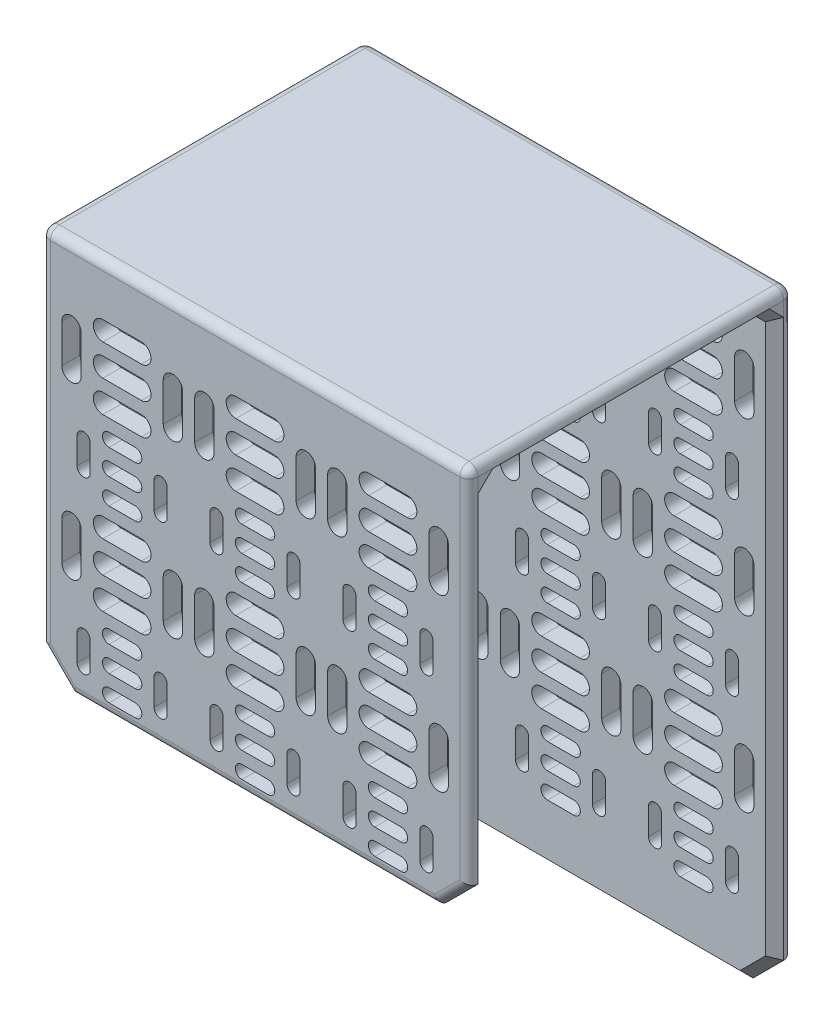
from build123d import *

# Parameters (mm, degrees)
ESQUISSE1_W                           = 70
ESQUISSE1_H                           = 100
BOSS_EXTRU_1_DEPTH                    = 3
ESQUISSE2_W                           = 70
ESQUISSE2_H                           = 3
BOSS_EXTRU_2_DEPTH                    = 50
ESQUISSE3_W                           = 70
ESQUISSE3_H                           = 3
BOSS_EXTRU_3_DEPTH                    = 61.2
ENL_V_MAT_EXTRU_1_DEPTH               = 79.89866919
R_P_TITION_LIN_AIRE1_COUNT            = 2
R_P_TITION_LIN_AIRE1_PITCH            = 27.9
R_P_TITION_LIN_AIRE1_COL_COUNT        = 2
R_P_TITION_LIN_AIRE1_COL_PITCH        = 27.9
R_P_TITION_LIN_AIRE2_COUNT            = 2
R_P_TITION_LIN_AIRE2_PITCH            = 21.75
R_P_TITION_LIN_AIRE2_COPY_1_DEPTH     = 79.89866919
R_P_TITION_LIN_AIRE2_COPY_2_DEPTH     = 79.89866919
R_P_TITION_LIN_AIRE2_COL_COUNT        = 2
R_P_TITION_LIN_AIRE2_COL_PITCH        = 21.75
R_P_TITION_LIN_AIRE2_COL_COPY_1_DEPTH = 79.89866919
R_P_TITION_LIN_AIRE2_COL_COPY_2_DEPTH = 79.89866919
CHANFREIN1_SIZE                       = 1.5
CHANFREIN2_SIZE                       = 5
CHANFREIN3_SIZE                       = 1.5
CONG_1_R                              = 1.5


with BuildPart() as part:
    # Esquisse1 → Boss.-Extru.1 (new body)
    with BuildSketch(Plane.XY):
        Rectangle(ESQUISSE1_W, ESQUISSE1_H)
    extrude(amount=BOSS_EXTRU_1_DEPTH)

    # Esquisse2 → Boss.-Extru.2 (add)
    with BuildSketch(Plane.XY.offset(3)):
        with Locations((0, 48.5)):
            Rectangle(ESQUISSE2_W, ESQUISSE2_H)
    extrude(amount=BOSS_EXTRU_2_DEPTH)

    # Esquisse3 → Boss.-Extru.3 (add)
    with BuildSketch(Plane.XZ.offset(-47)):
        with Locations((0, 51.5)):
            Rectangle(ESQUISSE3_W, ESQUISSE3_H)
    extrude(amount=BOSS_EXTRU_3_DEPTH)

    # Esquisse4 → Enlèv. mat.-Extru.1 (cut, symmetric)
    with BuildSketch(Plane.XY.offset(3)):
        with BuildLine():
            Line((3.15, 8.55), (-3.15, 8.55))
            ThreePointArc((-3.15, 8.55), (-4.725, 6.975), (-3.15, 5.4))
            Line((-3.15, 5.4), (0, 5.4))
            Line((0, 5.4), (3.15, 5.4))
            ThreePointArc((3.15, 5.4), (4.725, 6.975), (3.15, 8.55))
        make_face()
        with BuildLine():
            Line((9.875, 3.825), (9.875, 10.125))
            ThreePointArc((9.875, 10.125), (8.3, 11.7), (6.725, 10.125))
            Line((6.725, 10.125), (6.725, 3.825))
            ThreePointArc((6.725, 3.825), (8.3, 2.25), (9.875, 3.825))
        make_face()
        with BuildLine():
            Line((-6.725, 3.825), (-6.725, 10.125))
            ThreePointArc((-6.725, 10.125), (-8.3, 11.7), (-9.875, 10.125))
            Line((-9.875, 10.125), (-9.875, 3.825))
            ThreePointArc((-9.875, 3.825), (-8.3, 2.25), (-6.725, 3.825))
        make_face()
        with BuildLine():
            Line((2.15, -5.9), (-2.15, -5.9))
            ThreePointArc((-2.15, -5.9), (-3.225, -6.975), (-2.15, -8.05))
            Line((-2.15, -8.05), (0, -8.05))
            Line((0, -8.05), (2.15, -8.05))
            ThreePointArc((2.15, -8.05), (3.225, -6.975), (2.15, -5.9))
        make_face()
        with BuildLine():
            Line((7.375, -9.125), (7.375, -4.825))
            ThreePointArc((7.375, -4.825), (6.3, -3.75), (5.225, -4.825))
            Line((5.225, -4.825), (5.225, -9.125))
            ThreePointArc((5.225, -9.125), (6.3, -10.2), (7.375, -9.125))
        make_face()
        with BuildLine():
            Line((-5.225, -9.125), (-5.225, -4.825))
            ThreePointArc((-5.225, -4.825), (-6.3, -3.75), (-7.375, -4.825))
            Line((-7.375, -4.825), (-7.375, -9.125))
            ThreePointArc((-7.375, -9.125), (-6.3, -10.2), (-5.225, -9.125))
        make_face()
        with BuildLine():
            Line((3.15, 13.7), (-3.15, 13.7))
            ThreePointArc((-3.15, 13.7), (-4.725, 12.125), (-3.15, 10.55))
            Line((-3.15, 10.55), (3.15, 10.55))
            ThreePointArc((3.15, 10.55), (4.725, 12.125), (3.15, 13.7))
        make_face()
        with BuildLine():
            Line((3.15, 3.4), (-3.15, 3.4))
            ThreePointArc((-3.15, 3.4), (-4.725, 1.825), (-3.15, 0.25))
            Line((-3.15, 0.25), (3.15, 0.25))
            ThreePointArc((3.15, 0.25), (4.725, 1.825), (3.15, 3.4))
        make_face()
        with BuildLine():
            Line((2.15, -1.75), (-2.15, -1.75))
            ThreePointArc((-2.15, -1.75), (-3.225, -2.825), (-2.15, -3.9))
            Line((-2.15, -3.9), (2.15, -3.9))
            ThreePointArc((2.15, -3.9), (3.225, -2.825), (2.15, -1.75))
        make_face()
        with BuildLine():
            Line((2.15, -10.05), (-2.15, -10.05))
            ThreePointArc((-2.15, -10.05), (-3.225, -11.125), (-2.15, -12.2))
            Line((-2.15, -12.2), (2.15, -12.2))
            ThreePointArc((2.15, -12.2), (3.225, -11.125), (2.15, -10.05))
        make_face()
    enl_v_mat_extru_1 = extrude(amount=ENL_V_MAT_EXTRU_1_DEPTH, both=True, mode=Mode.SUBTRACT)

    # Répétition linéaire1: Enlèv. mat.-Extru.1 ×2
    with Locations(*[(0, -i * R_P_TITION_LIN_AIRE1_PITCH, 0) for i in range(1, R_P_TITION_LIN_AIRE1_COUNT)]):
        add(enl_v_mat_extru_1, mode=Mode.SUBTRACT)

    # Répétition linéaire1 col: Enlèv. mat.-Extru.1 ×2
    with Locations(*[(0, i * R_P_TITION_LIN_AIRE1_COL_PITCH, 0) for i in range(1, R_P_TITION_LIN_AIRE1_COL_COUNT)]):
        add(enl_v_mat_extru_1, mode=Mode.SUBTRACT)

    # Répétition linéaire2: Enlèv. mat.-Extru.1 ×2
    with Locations(*[(-i * R_P_TITION_LIN_AIRE2_PITCH, 0, 0) for i in range(1, R_P_TITION_LIN_AIRE2_COUNT)]):
        add(enl_v_mat_extru_1, mode=Mode.SUBTRACT)

    # Répétition linéaire2 copy 1 sketch → Répétition linéaire2 copy 1 (cut, symmetric)
    with BuildSketch(Plane(origin=(-21.75, -27.9, 3), x_dir=(1, 0, 0), z_dir=(0, 0, 1))):
        with BuildLine():
            Line((3.15, 8.55), (-3.15, 8.55))
            ThreePointArc((-3.15, 8.55), (-4.725, 6.975), (-3.15, 5.4))
            Line((-3.15, 5.4), (0, 5.4))
            Line((0, 5.4), (3.15, 5.4))
            ThreePointArc((3.15, 5.4), (4.725, 6.975), (3.15, 8.55))
        make_face()
        with BuildLine():
            Line((9.875, 3.825), (9.875, 10.125))
            ThreePointArc((9.875, 10.125), (8.3, 11.7), (6.725, 10.125))
            Line((6.725, 10.125), (6.725, 3.825))
            ThreePointArc((6.725, 3.825), (8.3, 2.25), (9.875, 3.825))
        make_face()
        with BuildLine():
            Line((-6.725, 3.825), (-6.725, 10.125))
            ThreePointArc((-6.725, 10.125), (-8.3, 11.7), (-9.875, 10.125))
            Line((-9.875, 10.125), (-9.875, 3.825))
            ThreePointArc((-9.875, 3.825), (-8.3, 2.25), (-6.725, 3.825))
        make_face()
        with BuildLine():
            Line((2.15, -5.9), (-2.15, -5.9))
            ThreePointArc((-2.15, -5.9), (-3.225, -6.975), (-2.15, -8.05))
            Line((-2.15, -8.05), (0, -8.05))
            Line((0, -8.05), (2.15, -8.05))
            ThreePointArc((2.15, -8.05), (3.225, -6.975), (2.15, -5.9))
        make_face()
        with BuildLine():
            Line((7.375, -9.125), (7.375, -4.825))
            ThreePointArc((7.375, -4.825), (6.3, -3.75), (5.225, -4.825))
            Line((5.225, -4.825), (5.225, -9.125))
            ThreePointArc((5.225, -9.125), (6.3, -10.2), (7.375, -9.125))
        make_face()
        with BuildLine():
            Line((-5.225, -9.125), (-5.225, -4.825))
            ThreePointArc((-5.225, -4.825), (-6.3, -3.75), (-7.375, -4.825))
            Line((-7.375, -4.825), (-7.375, -9.125))
            ThreePointArc((-7.375, -9.125), (-6.3, -10.2), (-5.225, -9.125))
        make_face()
        with BuildLine():
            Line((3.15, 13.7), (-3.15, 13.7))
            ThreePointArc((-3.15, 13.7), (-4.725, 12.125), (-3.15, 10.55))
            Line((-3.15, 10.55), (3.15, 10.55))
            ThreePointArc((3.15, 10.55), (4.725, 12.125), (3.15, 13.7))
        make_face()
        with BuildLine():
            Line((3.15, 3.4), (-3.15, 3.4))
            ThreePointArc((-3.15, 3.4), (-4.725, 1.825), (-3.15, 0.25))
            Line((-3.15, 0.25), (3.15, 0.25))
            ThreePointArc((3.15, 0.25), (4.725, 1.825), (3.15, 3.4))
        make_face()
        with BuildLine():
            Line((2.15, -1.75), (-2.15, -1.75))
            ThreePointArc((-2.15, -1.75), (-3.225, -2.825), (-2.15, -3.9))
            Line((-2.15, -3.9), (2.15, -3.9))
            ThreePointArc((2.15, -3.9), (3.225, -2.825), (2.15, -1.75))
        make_face()
        with BuildLine():
            Line((2.15, -10.05), (-2.15, -10.05))
            ThreePointArc((-2.15, -10.05), (-3.225, -11.125), (-2.15, -12.2))
            Line((-2.15, -12.2), (2.15, -12.2))
            ThreePointArc((2.15, -12.2), (3.225, -11.125), (2.15, -10.05))
        make_face()
    extrude(amount=R_P_TITION_LIN_AIRE2_COPY_1_DEPTH, both=True, mode=Mode.SUBTRACT)

    # Répétition linéaire2 copy 2 sketch → Répétition linéaire2 copy 2 (cut, symmetric)
    with BuildSketch(Plane(origin=(-21.75, 27.9, 3), x_dir=(1, 0, 0), z_dir=(0, 0, 1))):
        with BuildLine():
            Line((3.15, 8.55), (-3.15, 8.55))
            ThreePointArc((-3.15, 8.55), (-4.725, 6.975), (-3.15, 5.4))
            Line((-3.15, 5.4), (0, 5.4))
            Line((0, 5.4), (3.15, 5.4))
            ThreePointArc((3.15, 5.4), (4.725, 6.975), (3.15, 8.55))
        make_face()
        with BuildLine():
            Line((9.875, 3.825), (9.875, 10.125))
            ThreePointArc((9.875, 10.125), (8.3, 11.7), (6.725, 10.125))
            Line((6.725, 10.125), (6.725, 3.825))
            ThreePointArc((6.725, 3.825), (8.3, 2.25), (9.875, 3.825))
        make_face()
        with BuildLine():
            Line((-6.725, 3.825), (-6.725, 10.125))
            ThreePointArc((-6.725, 10.125), (-8.3, 11.7), (-9.875, 10.125))
            Line((-9.875, 10.125), (-9.875, 3.825))
            ThreePointArc((-9.875, 3.825), (-8.3, 2.25), (-6.725, 3.825))
        make_face()
        with BuildLine():
            Line((2.15, -5.9), (-2.15, -5.9))
            ThreePointArc((-2.15, -5.9), (-3.225, -6.975), (-2.15, -8.05))
            Line((-2.15, -8.05), (0, -8.05))
            Line((0, -8.05), (2.15, -8.05))
            ThreePointArc((2.15, -8.05), (3.225, -6.975), (2.15, -5.9))
        make_face()
        with BuildLine():
            Line((7.375, -9.125), (7.375, -4.825))
            ThreePointArc((7.375, -4.825), (6.3, -3.75), (5.225, -4.825))
            Line((5.225, -4.825), (5.225, -9.125))
            ThreePointArc((5.225, -9.125), (6.3, -10.2), (7.375, -9.125))
        make_face()
        with BuildLine():
            Line((-5.225, -9.125), (-5.225, -4.825))
            ThreePointArc((-5.225, -4.825), (-6.3, -3.75), (-7.375, -4.825))
            Line((-7.375, -4.825), (-7.375, -9.125))
            ThreePointArc((-7.375, -9.125), (-6.3, -10.2), (-5.225, -9.125))
        make_face()
        with BuildLine():
            Line((3.15, 13.7), (-3.15, 13.7))
            ThreePointArc((-3.15, 13.7), (-4.725, 12.125), (-3.15, 10.55))
            Line((-3.15, 10.55), (3.15, 10.55))
            ThreePointArc((3.15, 10.55), (4.725, 12.125), (3.15, 13.7))
        make_face()
        with BuildLine():
            Line((3.15, 3.4), (-3.15, 3.4))
            ThreePointArc((-3.15, 3.4), (-4.725, 1.825), (-3.15, 0.25))
            Line((-3.15, 0.25), (3.15, 0.25))
            ThreePointArc((3.15, 0.25), (4.725, 1.825), (3.15, 3.4))
        make_face()
        with BuildLine():
            Line((2.15, -1.75), (-2.15, -1.75))
            ThreePointArc((-2.15, -1.75), (-3.225, -2.825), (-2.15, -3.9))
            Line((-2.15, -3.9), (2.15, -3.9))
            ThreePointArc((2.15, -3.9), (3.225, -2.825), (2.15, -1.75))
        make_face()
        with BuildLine():
            Line((2.15, -10.05), (-2.15, -10.05))
            ThreePointArc((-2.15, -10.05), (-3.225, -11.125), (-2.15, -12.2))
            Line((-2.15, -12.2), (2.15, -12.2))
            ThreePointArc((2.15, -12.2), (3.225, -11.125), (2.15, -10.05))
        make_face()
    extrude(amount=R_P_TITION_LIN_AIRE2_COPY_2_DEPTH, both=True, mode=Mode.SUBTRACT)

    # Répétition linéaire2 col: Enlèv. mat.-Extru.1 ×2
    with Locations(*[(i * R_P_TITION_LIN_AIRE2_COL_PITCH, 0, 0) for i in range(1, R_P_TITION_LIN_AIRE2_COL_COUNT)]):
        add(enl_v_mat_extru_1, mode=Mode.SUBTRACT)

    # Répétition linéaire2 col copy 1 sketch → Répétition linéaire2 col copy 1 (cut, symmetric)
    with BuildSketch(Plane(origin=(21.75, -27.9, 3), x_dir=(1, 0, 0), z_dir=(0, 0, 1))):
        with BuildLine():
            Line((3.15, 8.55), (-3.15, 8.55))
            ThreePointArc((-3.15, 8.55), (-4.725, 6.975), (-3.15, 5.4))
            Line((-3.15, 5.4), (0, 5.4))
            Line((0, 5.4), (3.15, 5.4))
            ThreePointArc((3.15, 5.4), (4.725, 6.975), (3.15, 8.55))
        make_face()
        with BuildLine():
            Line((9.875, 3.825), (9.875, 10.125))
            ThreePointArc((9.875, 10.125), (8.3, 11.7), (6.725, 10.125))
            Line((6.725, 10.125), (6.725, 3.825))
            ThreePointArc((6.725, 3.825), (8.3, 2.25), (9.875, 3.825))
        make_face()
        with BuildLine():
            Line((-6.725, 3.825), (-6.725, 10.125))
            ThreePointArc((-6.725, 10.125), (-8.3, 11.7), (-9.875, 10.125))
            Line((-9.875, 10.125), (-9.875, 3.825))
            ThreePointArc((-9.875, 3.825), (-8.3, 2.25), (-6.725, 3.825))
        make_face()
        with BuildLine():
            Line((2.15, -5.9), (-2.15, -5.9))
            ThreePointArc((-2.15, -5.9), (-3.225, -6.975), (-2.15, -8.05))
            Line((-2.15, -8.05), (0, -8.05))
            Line((0, -8.05), (2.15, -8.05))
            ThreePointArc((2.15, -8.05), (3.225, -6.975), (2.15, -5.9))
        make_face()
        with BuildLine():
            Line((7.375, -9.125), (7.375, -4.825))
            ThreePointArc((7.375, -4.825), (6.3, -3.75), (5.225, -4.825))
            Line((5.225, -4.825), (5.225, -9.125))
            ThreePointArc((5.225, -9.125), (6.3, -10.2), (7.375, -9.125))
        make_face()
        with BuildLine():
            Line((-5.225, -9.125), (-5.225, -4.825))
            ThreePointArc((-5.225, -4.825), (-6.3, -3.75), (-7.375, -4.825))
            Line((-7.375, -4.825), (-7.375, -9.125))
            ThreePointArc((-7.375, -9.125), (-6.3, -10.2), (-5.225, -9.125))
        make_face()
        with BuildLine():
            Line((3.15, 13.7), (-3.15, 13.7))
            ThreePointArc((-3.15, 13.7), (-4.725, 12.125), (-3.15, 10.55))
            Line((-3.15, 10.55), (3.15, 10.55))
            ThreePointArc((3.15, 10.55), (4.725, 12.125), (3.15, 13.7))
        make_face()
        with BuildLine():
            Line((3.15, 3.4), (-3.15, 3.4))
            ThreePointArc((-3.15, 3.4), (-4.725, 1.825), (-3.15, 0.25))
            Line((-3.15, 0.25), (3.15, 0.25))
            ThreePointArc((3.15, 0.25), (4.725, 1.825), (3.15, 3.4))
        make_face()
        with BuildLine():
            Line((2.15, -1.75), (-2.15, -1.75))
            ThreePointArc((-2.15, -1.75), (-3.225, -2.825), (-2.15, -3.9))
            Line((-2.15, -3.9), (2.15, -3.9))
            ThreePointArc((2.15, -3.9), (3.225, -2.825), (2.15, -1.75))
        make_face()
        with BuildLine():
            Line((2.15, -10.05), (-2.15, -10.05))
            ThreePointArc((-2.15, -10.05), (-3.225, -11.125), (-2.15, -12.2))
            Line((-2.15, -12.2), (2.15, -12.2))
            ThreePointArc((2.15, -12.2), (3.225, -11.125), (2.15, -10.05))
        make_face()
    extrude(amount=R_P_TITION_LIN_AIRE2_COL_COPY_1_DEPTH, both=True, mode=Mode.SUBTRACT)

    # Répétition linéaire2 col copy 2 sketch → Répétition linéaire2 col copy 2 (cut, symmetric)
    with BuildSketch(Plane(origin=(21.75, 27.9, 3), x_dir=(1, 0, 0), z_dir=(0, 0, 1))):
        with BuildLine():
            Line((3.15, 8.55), (-3.15, 8.55))
            ThreePointArc((-3.15, 8.55), (-4.725, 6.975), (-3.15, 5.4))
            Line((-3.15, 5.4), (0, 5.4))
            Line((0, 5.4), (3.15, 5.4))
            ThreePointArc((3.15, 5.4), (4.725, 6.975), (3.15, 8.55))
        make_face()
        with BuildLine():
            Line((9.875, 3.825), (9.875, 10.125))
            ThreePointArc((9.875, 10.125), (8.3, 11.7), (6.725, 10.125))
            Line((6.725, 10.125), (6.725, 3.825))
            ThreePointArc((6.725, 3.825), (8.3, 2.25), (9.875, 3.825))
        make_face()
        with BuildLine():
            Line((-6.725, 3.825), (-6.725, 10.125))
            ThreePointArc((-6.725, 10.125), (-8.3, 11.7), (-9.875, 10.125))
            Line((-9.875, 10.125), (-9.875, 3.825))
            ThreePointArc((-9.875, 3.825), (-8.3, 2.25), (-6.725, 3.825))
        make_face()
        with BuildLine():
            Line((2.15, -5.9), (-2.15, -5.9))
            ThreePointArc((-2.15, -5.9), (-3.225, -6.975), (-2.15, -8.05))
            Line((-2.15, -8.05), (0, -8.05))
            Line((0, -8.05), (2.15, -8.05))
            ThreePointArc((2.15, -8.05), (3.225, -6.975), (2.15, -5.9))
        make_face()
        with BuildLine():
            Line((7.375, -9.125), (7.375, -4.825))
            ThreePointArc((7.375, -4.825), (6.3, -3.75), (5.225, -4.825))
            Line((5.225, -4.825), (5.225, -9.125))
            ThreePointArc((5.225, -9.125), (6.3, -10.2), (7.375, -9.125))
        make_face()
        with BuildLine():
            Line((-5.225, -9.125), (-5.225, -4.825))
            ThreePointArc((-5.225, -4.825), (-6.3, -3.75), (-7.375, -4.825))
            Line((-7.375, -4.825), (-7.375, -9.125))
            ThreePointArc((-7.375, -9.125), (-6.3, -10.2), (-5.225, -9.125))
        make_face()
        with BuildLine():
            Line((3.15, 13.7), (-3.15, 13.7))
            ThreePointArc((-3.15, 13.7), (-4.725, 12.125), (-3.15, 10.55))
            Line((-3.15, 10.55), (3.15, 10.55))
            ThreePointArc((3.15, 10.55), (4.725, 12.125), (3.15, 13.7))
        make_face()
        with BuildLine():
            Line((3.15, 3.4), (-3.15, 3.4))
            ThreePointArc((-3.15, 3.4), (-4.725, 1.825), (-3.15, 0.25))
            Line((-3.15, 0.25), (3.15, 0.25))
            ThreePointArc((3.15, 0.25), (4.725, 1.825), (3.15, 3.4))
        make_face()
        with BuildLine():
            Line((2.15, -1.75), (-2.15, -1.75))
            ThreePointArc((-2.15, -1.75), (-3.225, -2.825), (-2.15, -3.9))
            Line((-2.15, -3.9), (2.15, -3.9))
            ThreePointArc((2.15, -3.9), (3.225, -2.825), (2.15, -1.75))
        make_face()
        with BuildLine():
            Line((2.15, -10.05), (-2.15, -10.05))
            ThreePointArc((-2.15, -10.05), (-3.225, -11.125), (-2.15, -12.2))
            Line((-2.15, -12.2), (2.15, -12.2))
            ThreePointArc((2.15, -12.2), (3.225, -11.125), (2.15, -10.05))
        make_face()
    extrude(amount=R_P_TITION_LIN_AIRE2_COL_COPY_2_DEPTH, both=True, mode=Mode.SUBTRACT)

    # Chanfrein1
    chanfrein1_edges = [part.edges().sort_by_distance(p)[0] for p in [
        (0, 47, 3),
        (0, 47, 50),
    ]]
    chamfer(chanfrein1_edges, length=CHANFREIN1_SIZE)

    # Chanfrein2
    chanfrein2_edges = [part.edges().sort_by_distance(p)[0] for p in [
        (-35, -14.2, 51.5),
        (35, -14.2, 51.5),
        (35, -50, 1.5),
        (-35, -50, 1.5),
    ]]
    chamfer(chanfrein2_edges, length=CHANFREIN2_SIZE)

    # Chanfrein3
    chanfrein3_edges = [part.edges().sort_by_distance(p)[0] for p in [
        (-35, 47, 26.5),
        (35, 47, 26.5),
        (-35, 0.25, 3),
        (35, 46.25, 49.25),
        (-35, 46.25, 49.25),
        (35, 46.25, 3.75),
        (-35, 46.25, 3.75),
        (35, 18.15, 50),
        (35, 0.25, 3),
        (0, -50, 3),
        (-32.5, -47.5, 3),
        (32.5, -47.5, 3),
        (-35, 18.15, 50),
        (0, -14.2, 50),
        (-32.5, -11.7, 50),
        (32.5, -11.7, 50),
    ]]
    chamfer(chanfrein3_edges, length=CHANFREIN3_SIZE)

    # Congé1
    cong_1_edges = [part.edges().sort_by_distance(p)[0] for p in [
        (0, 50, 0),
        (35, 2.5, 0),
        (0, -50, 0),
        (-35, 2.5, 0),
        (0, 50, 53),
        (35, 50, 26.5),
        (32.5, -47.5, 0),
        (-32.5, -47.5, 0),
        (-35, 50, 26.5),
        (-35, 20.4, 53),
        (-32.5, -11.7, 53),
        (0, -14.2, 53),
        (32.5, -11.7, 53),
        (35, 20.4, 53),
        (-33.5, 18.460660172, 50),
    ]]
    fillet(cong_1_edges, radius=CONG_1_R - 0.0001)  # a hair under: the kernel refuses the full size


solid = part.part
